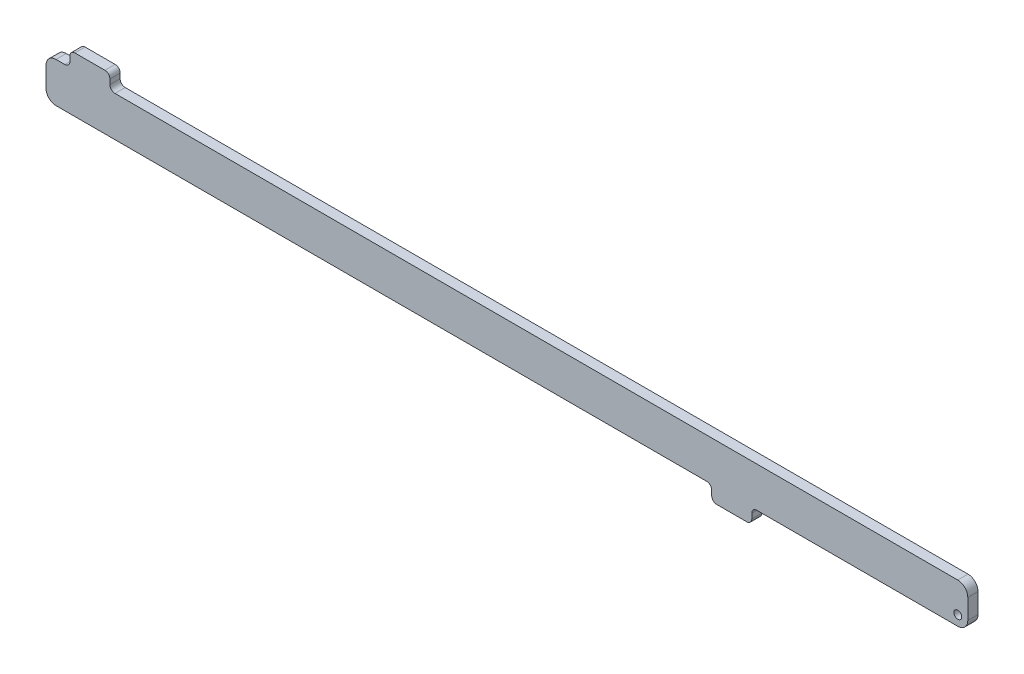
from build123d import *

# Parameters (mm, degrees)
SKETCH1_R           = 2.4892
BOSS_EXTRUDE1_DEPTH = 6.477
FILLET2_R           = 6.35
FILLET3_R           = 3.175


with BuildPart() as part:
    # Sketch1 → Boss-Extrude1 (new body)
    with BuildSketch(Plane.XY):
        Polygon((0, 25.4), (0, 0), (40.53078, 0), (421.903292844, 0), (421.903292844, -9.525), (447.303292844, -9.525), (447.303292844, 0), (584.2, 0), (584.2, 25.4), (40.530665192, 25.4), (40.530665192, 34.925), (15.130665192, 34.925), (15.130665192, 25.4), align=None)
        with Locations((577.85, 6.35)):
            Circle(SKETCH1_R, mode=Mode.SUBTRACT)
    extrude(amount=BOSS_EXTRUDE1_DEPTH)

    # Fillet2
    fillet2_edges = [part.edges().sort_by_distance(p)[0] for p in [
        (0, 0, 3.2385),
        (0, 25.4, 3.2385),
        (584.2, 0, 3.2385),
        (584.2, 25.4, 3.2385),
    ]]
    fillet(fillet2_edges, radius=FILLET2_R)

    # Fillet3
    fillet3_edges = [part.edges().sort_by_distance(p)[0] for p in [
        (15.130665192, 25.4, 3.2385),
        (15.130665192, 34.925, 3.2385),
        (40.530665192, 34.925, 3.2385),
        (40.530665192, 25.4, 3.2385),
        (421.903292844, 0, 3.2385),
        (421.903292844, -9.525, 3.2385),
        (447.303292844, -9.525, 3.2385),
        (447.303292844, 0, 3.2385),
    ]]
    fillet(fillet3_edges, radius=FILLET3_R)


solid = part.part
